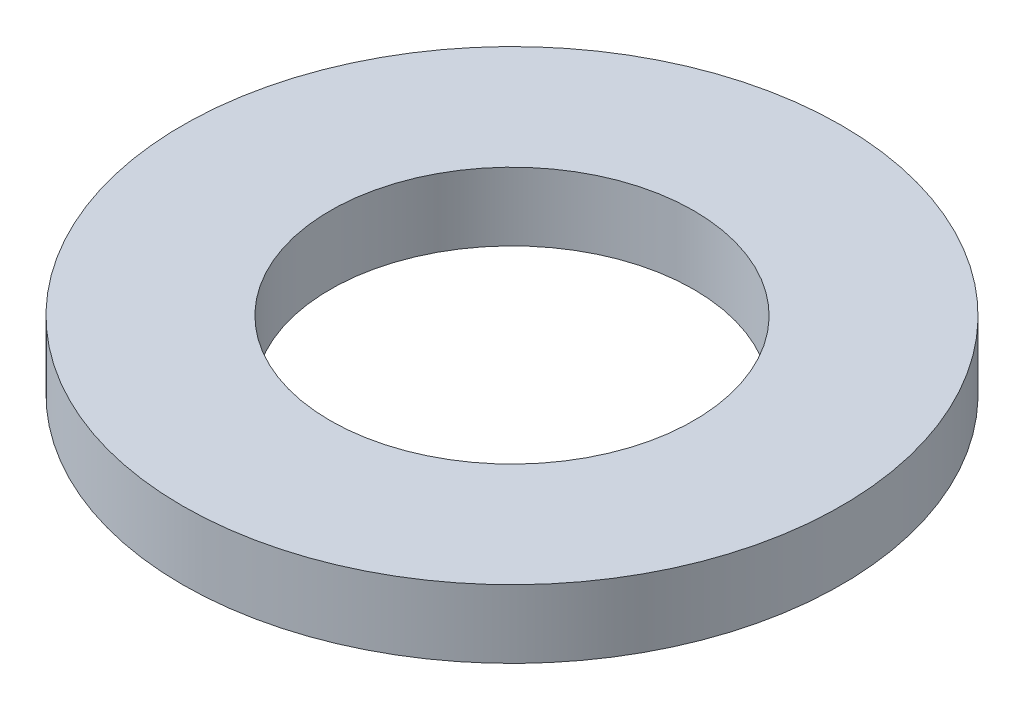
from build123d import *

# Parameters (mm, degrees)
SKETCH1_R           = 72.5
BOSS_EXTRUDE1_DEPTH = 15
SKETCH2_R           = 40
CUT_EXTRUDE1_DEPTH  = 104.62190888


with BuildPart() as part:
    # Sketch1 → Boss-Extrude1 (new body)
    with BuildSketch(Plane(origin=(0, 0, 0), x_dir=(1, 0, 0), z_dir=(0, 1, 0))):
        Circle(SKETCH1_R)
    extrude(amount=BOSS_EXTRUDE1_DEPTH)

    # Sketch2 → Cut-Extrude1 (cut, through all)
    with BuildSketch(Plane(origin=(0, 0, 0), x_dir=(1, 0, 0), z_dir=(0, 1, 0))):
        Circle(SKETCH2_R)
    extrude(amount=CUT_EXTRUDE1_DEPTH, mode=Mode.SUBTRACT)


solid = part.part
